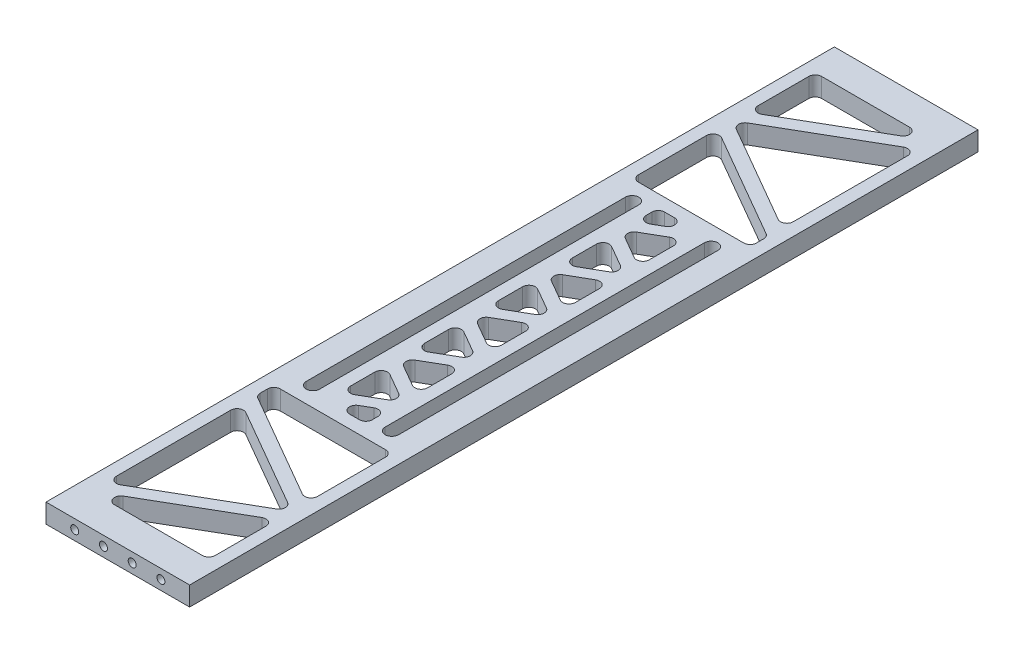
from build123d import *

# Parameters (mm, degrees)
SKETCH_1_W          = 45
SKETCH_1_H          = 247
EXTRUDE_1_DEPTH     = 6
CUT_EXTRUDE_1_DEPTH = 249.095243808
CUT_EXTRUDE_2_DEPTH = 249.095243808
FILLET_1_R          = 2
M3X0_52_D           = 2.5
M3X0_52_DEPTH       = 8.5
M3X0_52_TIP         = 0.751075774
M3X0_51_D           = 2.5
M3X0_51_DEPTH       = 8.5
M3X0_51_TIP         = 0.751075774


with BuildPart() as part:
    # Эскиз1 → Бобышка-Вытянуть1 (new body)
    with BuildSketch(Plane(origin=(0, 0, 0), x_dir=(1, 0, 0), z_dir=(0, 1, 0))):
        with Locations((0, -123.5)):
            Rectangle(SKETCH_1_W, SKETCH_1_H)
    extrude(amount=EXTRUDE_1_DEPTH)

    # Эскиз2 → Вырез-Вытянуть1 (cut, through all)
    with BuildSketch(Plane(origin=(0, 6, 0), x_dir=(1, 0, 0), z_dir=(0, 1, 0))):
        with BuildLine():
            Line((-10.274368671, -73.5), (-10.274368671, -173.5))
            ThreePointArc((-10.274368671, -173.5), (-12.374368671, -175.6), (-14.474368671, -173.5))
            Line((-14.474368671, -173.5), (-14.474368671, -73.5))
            ThreePointArc((-14.474368671, -73.5), (-12.374368671, -71.4), (-10.274368671, -73.5))
        make_face()
        with BuildLine():
            Line((10.274368671, -73.5), (10.274368671, -173.5))
            ThreePointArc((10.274368671, -173.5), (12.374368671, -175.6), (14.474368671, -173.5))
            Line((14.474368671, -173.5), (14.474368671, -73.5))
            ThreePointArc((14.474368671, -73.5), (12.374368671, -71.4), (10.274368671, -73.5))
        make_face()
    extrude(amount=-CUT_EXTRUDE_1_DEPTH, mode=Mode.SUBTRACT)

    # Эскиз14 → Вырез-Вытянуть2 (cut, through all)
    with BuildSketch(Plane(origin=(0, 6, 0), x_dir=(1, 0, 0), z_dir=(0, 1, 0))):
        Polygon((-18.5, -10), (18.5, -10), (-18.5, -31.36195996), align=None)
        Polygon((-18.5, -35.980762114), (18.5, -14.618802154), (18.5, -57.342722074), align=None)
        Polygon((-18.5, -40.599564267), (-18.5, -67.4), (18.5, -67.4), (18.5, -61.961524227), align=None)
        Polygon((6.274368671, -71.4), (-6.274368671, -78.645016882), (-6.274368671, -71.4), align=None)
        Polygon((6.274368671, -75.730127019), (-6.274368671, -82.975143901), (6.274368671, -90.220160783), align=None)
        Polygon((-6.274368671, -87.30527092), (6.274368671, -94.550287802), (-6.274368671, -101.795304684), align=None)
        Polygon((-6.274368671, -106.125431703), (6.274368671, -98.880414821), (6.274368671, -113.370448585), align=None)
        Polygon((-6.274368671, -110.455558722), (6.274368671, -117.700575604), (-6.274368671, -124.945592486), align=None)
        Polygon((-6.274368671, -129.275719505), (6.274368671, -122.030702623), (6.274368671, -136.520736387), align=None)
        Polygon((-6.274368671, -133.605846524), (6.274368671, -140.850863406), (-6.274368671, -148.095880288), align=None)
        Polygon((-6.274368671, -152.426007307), (6.274368671, -145.180990425), (6.274368671, -159.671024189), align=None)
        Polygon((-6.274368671, -156.756134326), (6.274368671, -164.001151208), (-6.274368671, -171.24616809), align=None)
        Polygon((-6.274368671, -175.576295109), (6.274368671, -168.331278227), (6.274368671, -175.576295109), align=None)
        Polygon((-18.5, -179.6), (-18.5, -185.038475773), (18.5, -206.400435733), (18.5, -179.6), align=None)
        Polygon((-18.5, -232.381197846), (-18.5, -189.657277926), (18.5, -211.019237886), align=None)
        Polygon((18.5, -215.63804004), (18.5, -237), (-18.5, -237), align=None)
    extrude(amount=-CUT_EXTRUDE_2_DEPTH, mode=Mode.SUBTRACT)

    # Скругление1
    fillet_1_edges = [part.edges().sort_by_distance(p)[0] for p in [
        (-6.274368671, 3, 175.576295109),
        (6.274368671, 3, 175.576295109),
        (6.274368671, 3, 168.331278227),
        (6.274368671, 3, 145.180990425),
        (-6.274368671, 3, 152.426007307),
        (-6.274368671, 3, 156.756134326),
        (6.274368671, 3, 164.001151208),
        (6.274368671, 3, 159.671024189),
        (-6.274368671, 3, 171.24616809),
        (-6.274368671, 3, 148.095880288),
        (6.274368671, 3, 140.850863406),
        (-6.274368671, 3, 133.605846524),
        (6.274368671, 3, 122.030702623),
        (6.274368671, 3, 136.520736387),
        (-6.274368671, 3, 129.275719505),
        (6.274368671, 3, 117.700575604),
        (-6.274368671, 3, 110.455558722),
        (-6.274368671, 3, 124.945592486),
        (-6.274368671, 3, 101.795304684),
        (6.274368671, 3, 94.550287802),
        (-6.274368671, 3, 106.125431703),
        (6.274368671, 3, 113.370448585),
        (6.274368671, 3, 98.880414821),
        (-6.274368671, 3, 87.30527092),
        (6.274368671, 3, 90.220160783),
        (6.274368671, 3, 75.730127019),
        (-6.274368671, 3, 82.975143901),
        (-6.274368671, 3, 78.645016882),
        (-6.274368671, 3, 71.4),
        (6.274368671, 3, 71.4),
        (-18.5, 3, 40.599564267),
        (-18.5, 3, 67.4),
        (18.5, 3, 67.4),
        (18.5, 3, 61.961524227),
        (18.5, 3, 57.342722074),
        (18.5, 3, 14.618802154),
        (-18.5, 3, 35.980762114),
        (-18.5, 3, 31.36195996),
        (18.5, 3, 10),
        (-18.5, 3, 10),
        (18.5, 3, 237),
        (18.5, 3, 215.63804004),
        (-18.5, 3, 237),
        (-18.5, 3, 232.381197846),
        (18.5, 3, 211.019237886),
        (-18.5, 3, 189.657277926),
        (18.5, 3, 206.400435733),
        (-18.5, 3, 185.038475773),
        (-18.5, 3, 179.6),
        (18.5, 3, 179.6),
    ]]
    fillet(fillet_1_edges, radius=FILLET_1_R)

    # Отверстие обработанное метчиком M3x0.52
    with Locations(Plane(origin=(0, 0, 0), x_dir=(-1, 0, 0), z_dir=(0, 0, -1))):
        with Locations((-13.5, 3), (-4.5, 3), (4.5, 3), (13.5, 3)):
            Hole(M3X0_52_D / 2, depth=M3X0_52_DEPTH)
            with Locations((0, 0, -(M3X0_52_DEPTH + M3X0_52_TIP / 2))):  # 118° drill point
                Cone(0, M3X0_52_D / 2, M3X0_52_TIP, mode=Mode.SUBTRACT)

    # Отверстие обработанное метчиком M3x0.51
    with Locations(Plane.XY.offset(247)):
        with Locations((-13.5, 3), (-4.5, 3), (4.5, 3), (13.5, 3)):
            Hole(M3X0_51_D / 2, depth=M3X0_51_DEPTH)
            with Locations((0, 0, -(M3X0_51_DEPTH + M3X0_51_TIP / 2))):  # 118° drill point
                Cone(0, M3X0_51_D / 2, M3X0_51_TIP, mode=Mode.SUBTRACT)


solid = part.part
